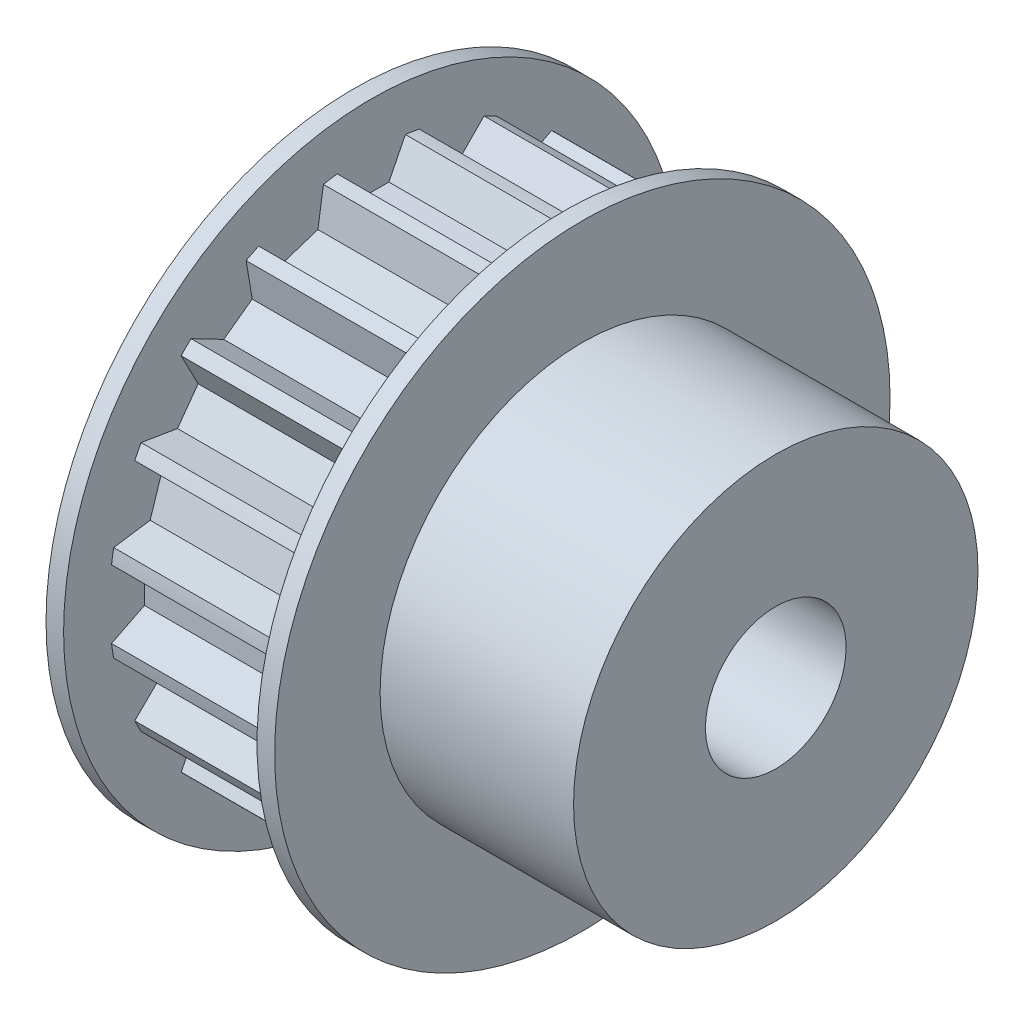
from build123d import *
from build123d.topology import SkipClean

# Parameters (mm, degrees)
SKETCH1_R           = 14.9
SKETCH1_R_2         = 4
BOSS_EXTRUDE1_DEPTH = 5.5
SKETCH2_R           = 11.5
SKETCH2_R_2         = 4
BOSS_EXTRUDE2_DEPTH = 12
CUT_EXTRUDE2_DEPTH  = 11
CIRPATTERN2_COUNT   = 20
BOSS_EXTRUDE3_START = 1
SKETCH7_R           = 17.5
SKETCH7_R_2         = 4
BOSS_EXTRUDE3_DEPTH = 1
SKETCH8_R           = 17.5
SKETCH8_R_2         = 4
BOSS_EXTRUDE4_DEPTH = 1


with BuildPart() as part:
    # Sketch1 → Boss-Extrude1 (new, symmetric)
    with BuildSketch(Plane(origin=(0, 0, 0), x_dir=(0, 0, -1), z_dir=(1, 0, 0))):
        Circle(SKETCH1_R)
        Circle(SKETCH1_R_2, mode=Mode.SUBTRACT)
    extrude(amount=BOSS_EXTRUDE1_DEPTH, both=True)

    # Sketch2 → Boss-Extrude2 (add)
    with BuildSketch(Plane(origin=(5.5, 0, 0), x_dir=(0, 0, -1), z_dir=(1, 0, 0))):
        Circle(SKETCH2_R)
        Circle(SKETCH2_R_2, mode=Mode.SUBTRACT)
    extrude(amount=BOSS_EXTRUDE2_DEPTH)

    # Sketch6 → Cut-Extrude2 (cut)
    with BuildSketch(Plane.ZY.offset(5.5)):
        Polygon((-1, 12.9), (1, 12.9), (2, 14.9), (-2, 14.9), align=None)
    cut_extrude2 = extrude(amount=-CUT_EXTRUDE2_DEPTH, mode=Mode.SUBTRACT)

    # CirPattern2: Cut-Extrude2 ×20 about axis
    cirpattern2_axis = Axis((0, 0, 0), (1, 0, 0))
    for i in range(1, CIRPATTERN2_COUNT):
        add(cut_extrude2.rotate(cirpattern2_axis, i * 360 / CIRPATTERN2_COUNT), mode=Mode.SUBTRACT)

    # Sketch7 → Boss-Extrude3 (add)
    with SkipClean():  # the faces are left unmerged after this step: merging them gives an invalid solid
        with BuildSketch(Plane.ZY.offset(5.5).offset(BOSS_EXTRUDE3_START)):
            Circle(SKETCH7_R)
            Circle(SKETCH7_R_2, mode=Mode.SUBTRACT)
        extrude(amount=-BOSS_EXTRUDE3_DEPTH)

    # Sketch8 → Boss-Extrude4 (add)
    with SkipClean():  # the faces are left unmerged after this step: merging them gives an invalid solid
        with BuildSketch(Plane(origin=(5.5, 0, 0), x_dir=(0, 0, -1), z_dir=(1, 0, 0))):
            with Locations(Location((0, 0, 0), (0, 0, 180))):
                Circle(SKETCH8_R)
            with Locations(Location((0, 0, 0), (0, 0, 180))):
                Circle(SKETCH8_R_2, mode=Mode.SUBTRACT)
        extrude(amount=BOSS_EXTRUDE4_DEPTH)
    add(part.part.scale(1), mode=Mode.REPLACE)  # the faces are merged on a copy


solid = part.part
